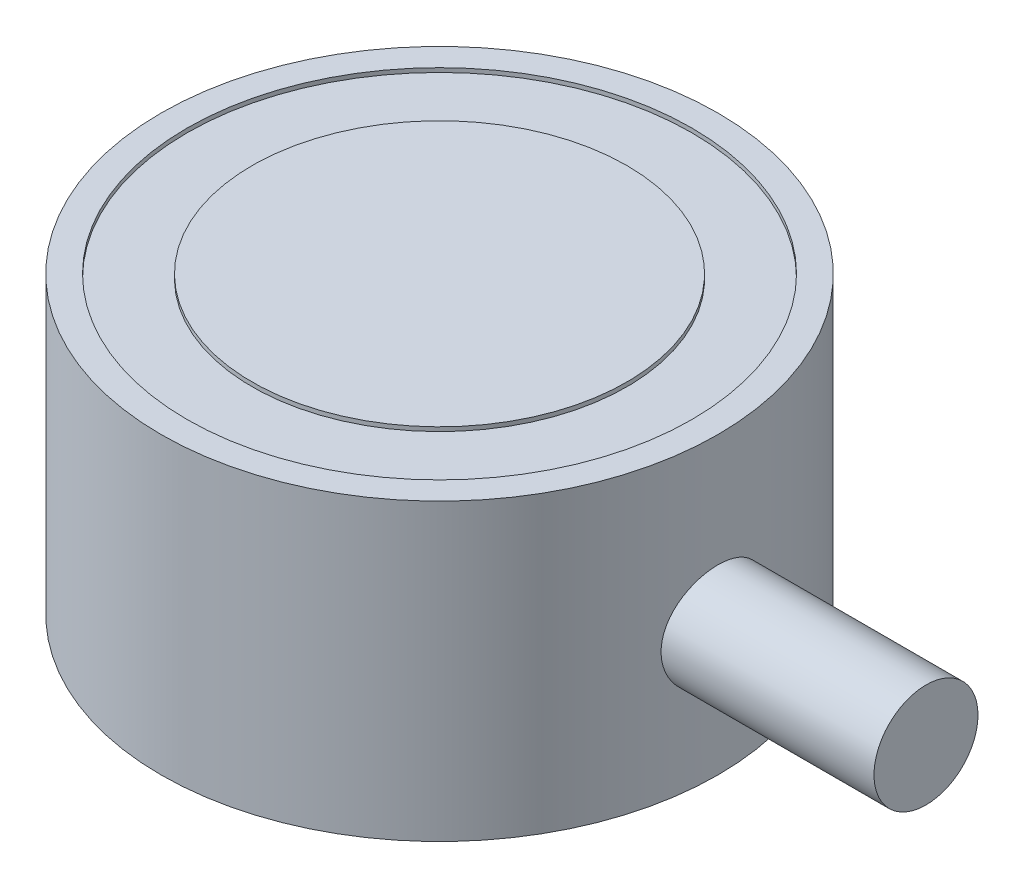
from build123d import *

# Parameters (mm, degrees)
SKETCH1_R                    = 17
BOSS_EXTRUDE1_DEPTH          = 18
SKETCH2_W                    = 3.96875
SKETCH2_H                    = 0.254
SKETCH3_R                    = 2.413
CUT_EXTRUDE1_DEPTH           = 9.525
SWEEP1_PITCH                 = 0.79375
SKETCH6_R                    = 2.498925958
CUT_EXTRUDE2_OTHER_WAY_DEPTH = 31.033314949
BOSS_EXTRUDE2_START          = 29.7
SKETCH7_R                    = 3.175
BOSS_EXTRUDE2_DEPTH          = 12.999120532


with BuildPart() as part:
    # Sketch1 → Boss-Extrude1 (new body)
    with BuildSketch(Plane(origin=(0, 0, 0), x_dir=(1, 0, 0), z_dir=(0, 1, 0))):
        with Locations(Location((0, 0, 0), (0, 0, 270))):
            Circle(SKETCH1_R)
    extrude(amount=BOSS_EXTRUDE1_DEPTH)

    # Sketch2 → Cut-Revolve1 (revolve, cut)
    with BuildSketch(Plane.XY, mode=Mode.PRIVATE) as cut_revolve1_sk:
        with Locations((-13.428125, 17.873)):
            Rectangle(SKETCH2_W, SKETCH2_H)
    revolve(cut_revolve1_sk.sketch.rotate(Axis((0, 0, 0), (0, 1, 0)), 270), axis=Axis((0, 0, 0), (0, 1, 0)), mode=Mode.SUBTRACT)

    # Sketch3 → Cut-Extrude1 (cut)
    with BuildSketch(Plane.XZ):
        with Locations(Location((0, 0, 0), (0, 0, 270))):
            Circle(SKETCH3_R)
    extrude(amount=-CUT_EXTRUDE1_DEPTH, mode=Mode.SUBTRACT)

    # Sweep1: the profile of Sketch5 screwed along a right-hand helix of 13 turns, 8 arcs to a turn; built about Z, then put on its axis
    sweep1_z = Axis((0, 0, 0), (0, 0, 1))
    sweep1_corners = [(2.455962979, 0, -0.719335938), (2.455962979, 0, 0.024804688), (1.98337021, 0, -0.248046875), (1.98337021, 0, -0.446484375)]
    with BuildLine(mode=Mode.PRIVATE) as sweep1_profile:
        Line(sweep1_corners[0], sweep1_corners[1])
        Line(sweep1_corners[1], sweep1_corners[2])
        Line(sweep1_corners[2], sweep1_corners[3])
        Line(sweep1_corners[3], sweep1_corners[0])
    sweep1_cap = Face(sweep1_profile.wire())
    sweep1_turn_angles = [0, 22.5, 45, 67.5, 90, 112.5, 135, 157.5, 180, 202.5, 225, 247.5, 270, 292.5, 315, 337.5, 360]
    sweep1_turn_weights = [1, 0.9238795325112867, 1, 0.9238795325112867, 1, 0.9238795325112867, 1, 0.9238795325112867, 1, 0.9238795325112867, 1, 0.9238795325112867, 1, 0.9238795325112867, 1, 0.9238795325112867, 1]
    sweep1_turn_rails = [Edge.make_bspline([Vector(p[0], p[1], 0).rotate(sweep1_z, sweep1_turn_angles[k]) / sweep1_turn_weights[k] + Vector(0, 0, p[2] + SWEEP1_PITCH * sweep1_turn_angles[k] / 360) for k in range(17)], [0, 0, 0, 1, 1, 2, 2, 3, 3, 4, 4, 5, 5, 6, 6, 7, 7, 8, 8, 8], 2, sweep1_turn_weights) for p in sweep1_corners]
    sweep1_turn_sides = [Face.make_surface_from_curves(sweep1_turn_rails[p[0]], sweep1_turn_rails[p[1]]) for p in [(0, 1), (1, 2), (2, 3), (3, 0)]]
    sweep1 = Plane(origin=(0, 0, 0), x_dir=(-1, 0, 0), z_dir=(0, 1, 0)) * Solid(Shell([*[p.moved(Location((0, 0, SWEEP1_PITCH * i))) for i in range(13) for p in sweep1_turn_sides], sweep1_cap, sweep1_cap.rotate(sweep1_z, 4680).moved(Location((0, 0, SWEEP1_PITCH * 4680 / 360)))]))
    add(sweep1)

    # Cut-Extrude2 cone 1 section (through the dimple's axis) → Cut-Extrude2 (revolve, cut)
    with BuildSketch(Plane(origin=(0, 0, 0), x_dir=(0, 0, -1), z_dir=(1, 0, 0))):
        Polygon((0, 0), (2.498925958, 0), (0, 2.498925958), align=None)
    revolve(axis=Axis((0, 0, 0), (0, 1, 0)), mode=Mode.SUBTRACT)

    # Sketch6 → Cut-Extrude2 other way (cut)
    with BuildSketch(Plane.XZ):
        Circle(SKETCH6_R)
    extrude(amount=CUT_EXTRUDE2_OTHER_WAY_DEPTH, mode=Mode.SUBTRACT)

    # Sketch7 → Boss-Extrude2 (add)
    with BuildSketch(Plane(origin=(0, 0, 0), x_dir=(0, 0, -1), z_dir=(1, 0, 0)).offset(BOSS_EXTRUDE2_START)):
        with Locations((0, 7.9375)):
            Circle(SKETCH7_R)
    extrude(amount=-BOSS_EXTRUDE2_DEPTH)


solid = part.part
